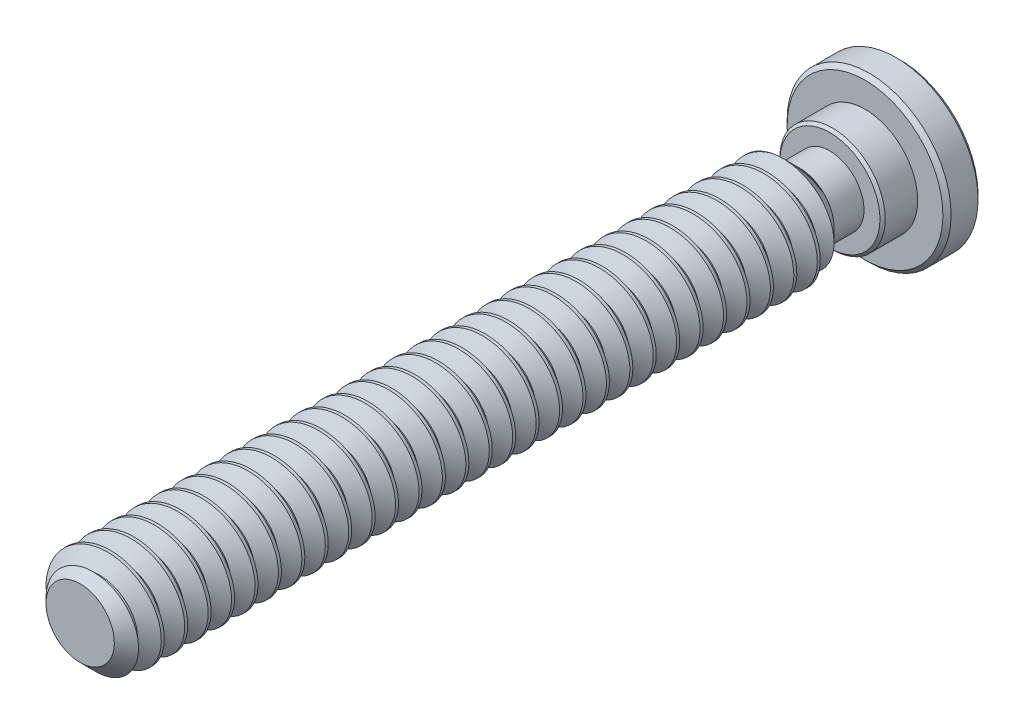
from build123d import *

# Parameters (mm, degrees)
CHAMFER2_SIZE      = 0.5953125
CUT_EXTRUDE1_DEPTH = 1.190625
CHAMFER1_SIZE      = 0.13890625
CHAMFER3_SIZE      = 0.089296875
CUT_SWEEP1_PITCH   = 0.79375


with BuildPart() as part:
    # Sketch13 → Revolve1 (revolve)
    with BuildSketch(Plane(origin=(0, 0, 0), x_dir=(0, 0, -1), z_dir=(1, 0, 0)), mode=Mode.PRIVATE) as revolve1_sk:
        Polygon((1.190625, 2.778125), (0, 2.778125), (0, 1.7859375), (-1.190625, 1.7859375), (-1.190625, 1.1572875), (-2.206625, 1.1572875), (-2.8019375, 1.7526), (-26.590625, 1.7526), (-26.590625, 0), (1.190625, 0), align=None)
    revolve(revolve1_sk.sketch.rotate(Axis((0, 0, 26.590625), (0, 0, -1)), 180), axis=Axis((0, 0, 26.590625), (0, 0, -1)))

    # Chamfer2
    chamfer2_edges = [part.edges().sort_by_distance(p)[0] for p in [
        (0, 1.7526, 26.590625),
    ]]
    chamfer(chamfer2_edges, length=CHAMFER2_SIZE)

    # Sketch7 → Cut-Extrude1 (cut)
    with BuildSketch(Plane(origin=(0, 0, -1.190625), x_dir=(-1, 0, 0), z_dir=(0, 0, -1))):
        Polygon((0, 0.916543552), (-0.79375, 0.458271776), (-0.79375, -0.458271776), (0, -0.916543552), (0.79375, -0.458271776), (0.79375, 0.458271776), align=None)
    extrude(amount=-CUT_EXTRUDE1_DEPTH, mode=Mode.SUBTRACT)

    # Chamfer1
    chamfer1_edges = [part.edges().sort_by_distance(p)[0] for p in [
        (0, 2.778125, 0),
        (0, 2.778125, -1.190625),
    ]]
    chamfer(chamfer1_edges, length=CHAMFER1_SIZE)

    # Cut-Extrude2 cone 1 section (through the dimple's axis) → Cut-Extrude2 (revolve, cut)
    with BuildSketch(Plane(origin=(0, 0, -1.190625), x_dir=(0, 1, 0), z_dir=(1, 0, 0))):
        Polygon((0, 0), (0.916543552, 0), (0, 0.916543552), align=None)
    revolve(axis=Axis((0, 0, -1.190625), (0, 0, 1)), mode=Mode.SUBTRACT)

    # Chamfer3
    chamfer3_edges = [part.edges().sort_by_distance(p)[0] for p in [
        (0, 1.7859375, 1.190625),
    ]]
    chamfer(chamfer3_edges, length=CHAMFER3_SIZE)

    # Cut-Sweep1: the profile of Sketch3 screwed along a right-hand helix of 31.68 turns, 6 arcs to a turn; built about Z, then put on its axis
    cut_sweep1_z = Axis((0, 0, 0), (0, 0, 1))
    cut_sweep1_corners = [(1.795562979, 0, -0.719335937), (1.795562979, 0, 0.024804688), (1.237044252, 0, -0.29765625), (1.237044252, 0, -0.396875)]
    with BuildLine(mode=Mode.PRIVATE) as cut_sweep1_profile:
        Line(cut_sweep1_corners[0], cut_sweep1_corners[1])
        Line(cut_sweep1_corners[1], cut_sweep1_corners[2])
        Line(cut_sweep1_corners[2], cut_sweep1_corners[3])
        Line(cut_sweep1_corners[3], cut_sweep1_corners[0])
    cut_sweep1_cap = Face(cut_sweep1_profile.wire())
    cut_sweep1_turn_angles = [0, 30, 60, 90, 120, 150, 180, 210, 240, 270, 300, 330, 360]
    cut_sweep1_turn_weights = [1, 0.8660254037844387, 1, 0.8660254037844387, 1, 0.8660254037844387, 1, 0.8660254037844387, 1, 0.8660254037844387, 1, 0.8660254037844387, 1]
    cut_sweep1_turn_rails = [Edge.make_bspline([Vector(p[0], p[1], 0).rotate(cut_sweep1_z, cut_sweep1_turn_angles[k]) / cut_sweep1_turn_weights[k] + Vector(0, 0, p[2] + CUT_SWEEP1_PITCH * cut_sweep1_turn_angles[k] / 360) for k in range(13)], [0, 0, 0, 1, 1, 2, 2, 3, 3, 4, 4, 5, 5, 6, 6, 6], 2, cut_sweep1_turn_weights) for p in cut_sweep1_corners]
    cut_sweep1_turn_sides = [Face.make_surface_from_curves(cut_sweep1_turn_rails[p[0]], cut_sweep1_turn_rails[p[1]]) for p in [(0, 1), (1, 2), (2, 3), (3, 0)]]
    cut_sweep1_last_angles = [11160, 11190, 11220, 11250, 11280, 11310, 11340, 11370, 11400, 11402.4, 11404.8]
    cut_sweep1_last_weights = [1, 0.8660254037844387, 1, 0.8660254037844387, 1, 0.8660254037844387, 1, 0.8660254037844387, 1, 0.9991228300987934, 1]
    cut_sweep1_last_rails = [Edge.make_bspline([Vector(p[0], p[1], 0).rotate(cut_sweep1_z, cut_sweep1_last_angles[k]) / cut_sweep1_last_weights[k] + Vector(0, 0, p[2] + CUT_SWEEP1_PITCH * cut_sweep1_last_angles[k] / 360) for k in range(11)], [0, 0, 0, 1, 1, 2, 2, 3, 3, 4, 4, 5, 5, 5], 2, cut_sweep1_last_weights) for p in cut_sweep1_corners]
    cut_sweep1_last_sides = [Face.make_surface_from_curves(cut_sweep1_last_rails[p[0]], cut_sweep1_last_rails[p[1]]) for p in [(0, 1), (1, 2), (2, 3), (3, 0)]]
    cut_sweep1 = Plane(origin=(0, 0, 26.590625), x_dir=(0, 1, 0), z_dir=(0, 0, -1)) * Solid(Shell([*[p.moved(Location((0, 0, CUT_SWEEP1_PITCH * i))) for i in range(31) for p in cut_sweep1_turn_sides], *cut_sweep1_last_sides, cut_sweep1_cap, cut_sweep1_cap.rotate(cut_sweep1_z, 11404.8).moved(Location((0, 0, CUT_SWEEP1_PITCH * 11404.8 / 360)))]))
    add(cut_sweep1, mode=Mode.SUBTRACT)


solid = part.part
